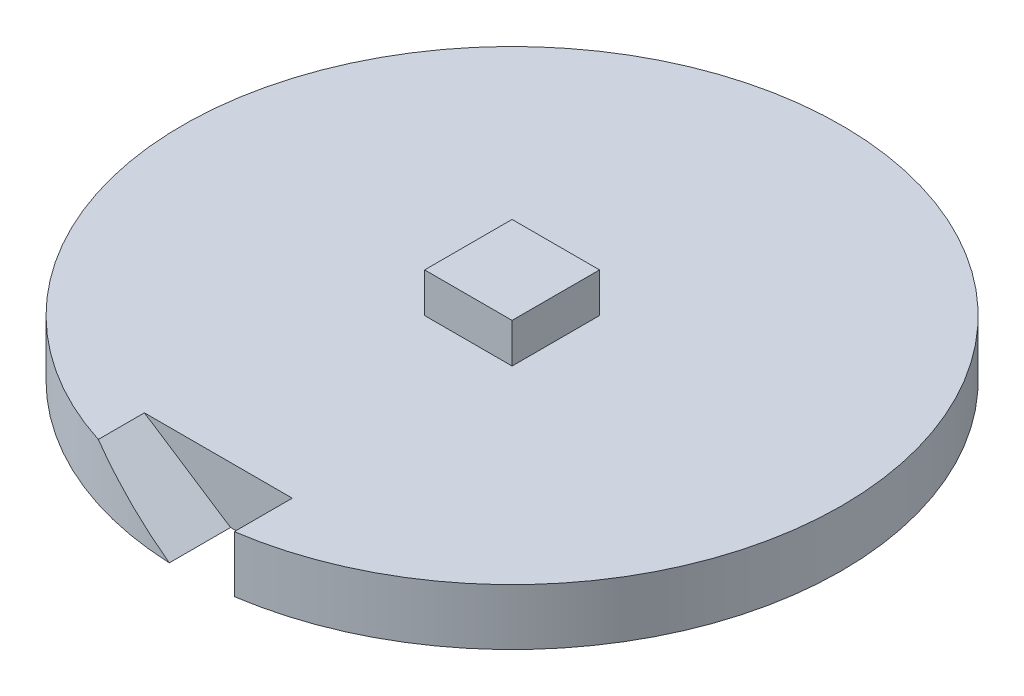
from build123d import *

# Parameters (mm, degrees)
SKETCH1_R           = 37.5
BOSS_EXTRUDE1_DEPTH = 6.4
SKETCH9_W           = 9.95
SKETCH9_H           = 9.95
BOSS_EXTRUDE2_DEPTH = 10.9
SKETCH2_R           = 5
BOSS_EXTRUDE3_DEPTH = 10
CUT_EXTRUDE5_DEPTH  = 10
CUT_EXTRUDE9_DEPTH  = 7


with BuildPart() as part:
    # Sketch1 → Boss-Extrude1 (new body)
    with BuildSketch(Plane(origin=(0, 0, 0), x_dir=(1, 0, 0), z_dir=(0, 1, 0))):
        Circle(SKETCH1_R)
    extrude(amount=BOSS_EXTRUDE1_DEPTH)

    # Sketch9 → Boss-Extrude2 (add)
    with BuildSketch(Plane(origin=(0, 0, 0), x_dir=(1, 0, 0), z_dir=(0, 1, 0))):
        Rectangle(SKETCH9_W, SKETCH9_H)
    extrude(amount=BOSS_EXTRUDE2_DEPTH)

    # Sketch2 → Boss-Extrude3 (add)
    with BuildSketch(Plane.XZ):
        Circle(SKETCH2_R)
    extrude(amount=BOSS_EXTRUDE3_DEPTH)

    # Sketch11 → Cut-Extrude5 (cut)
    with BuildSketch(Plane.XZ.offset(10)):
        with BuildLine():
            Line((0.018011531, -1.443232403), (0.565734089, -1.443232403))
            ThreePointArc((0.565734089, -1.443232403), (0.018011531, 1.556767597), (-0.529711026, -1.443232403))
            Line((-0.529711026, -1.443232403), (0.018011531, -1.443232403))
        make_face()
    extrude(amount=-CUT_EXTRUDE5_DEPTH, mode=Mode.SUBTRACT)

    # Sketch14 → Cut-Extrude9 (cut)
    with BuildSketch(Plane.XY.offset(37.5)):
        Polygon((-1.479409771, -0.034279728), (-11.335299807, 6.4), (5.487832291, 6.4), (5.487832291, 5.965720272), (5.487832291, -0.034279728), align=None)
    extrude(amount=-CUT_EXTRUDE9_DEPTH, mode=Mode.SUBTRACT)


solid = part.part
